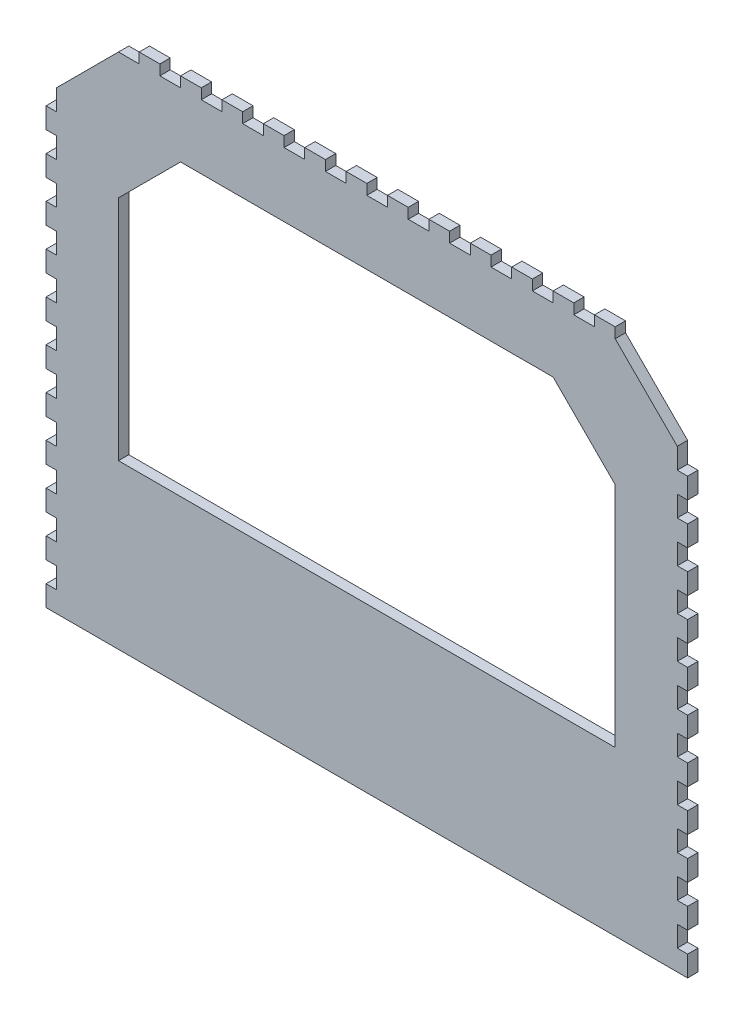
from build123d import *

# Parameters (mm, degrees)
AUFSATZ_LINEAR_AUSTRAGEN1_DEPTH = 5


with BuildPart() as part:
    # Skizze1 → Aufsatz-Linear austragen1 (new body)
    with BuildSketch(Plane.XY):
        Polygon((430.89618142, 326.340211581), (430.89618142, 336.340211581), (425.89618142, 336.340211581), (425.89618142, 346.340211581), (430.89618142, 346.340211581), (430.89618142, 356.340211581), (425.89618142, 356.340211581), (425.89618142, 366.340211581), (430.89618142, 366.340211581), (430.89618142, 376.340211581), (425.89618142, 376.340211581), (425.89618142, 386.340211581), (430.89618142, 386.340211581), (430.89618142, 396.340211581), (425.89618142, 396.340211581), (425.89618142, 406.340211581), (430.89618142, 406.340211581), (430.89618142, 416.340211581), (425.89618142, 416.340211581), (425.89618142, 426.340211581), (430.89618142, 426.340211581), (430.89618142, 436.340211581), (425.89618142, 436.340211581), (425.89618142, 446.340211581), (430.89618142, 446.340211581), (430.89618142, 456.340211581), (425.89618142, 456.340211581), (425.89618142, 466.340211581), (430.89618142, 466.340211581), (430.89618142, 476.340211581), (425.89618142, 476.340211581), (425.89618142, 486.340211581), (430.89618142, 486.340211581), (430.89618142, 496.340211581), (425.89618142, 496.340211581), (425.89618142, 506.340211581), (430.89618142, 506.340211581), (430.89618142, 516.340211581), (425.89618142, 516.340211581), (425.89618142, 526.340211581), (430.89618142, 526.340211581), (430.89618142, 536.340211581), (460.89618142, 566.340211581), (470.89618142, 566.340211581), (470.89618142, 571.340211581), (480.89618142, 571.340211581), (480.89618142, 566.340211581), (490.89618142, 566.340211581), (490.89618142, 571.340211581), (500.89618142, 571.340211581), (500.89618142, 566.340211581), (510.89618142, 566.340211581), (510.89618142, 571.340211581), (520.89618142, 571.340211581), (520.89618142, 566.340211581), (530.89618142, 566.340211581), (530.89618142, 571.340211581), (540.89618142, 571.340211581), (540.89618142, 566.340211581), (550.89618142, 566.340211581), (550.89618142, 571.340211581), (560.89618142, 571.340211581), (560.89618142, 566.340211581), (570.89618142, 566.340211581), (570.89618142, 571.340211581), (580.89618142, 571.340211581), (580.89618142, 566.340211581), (590.89618142, 566.340211581), (590.89618142, 571.340211581), (600.89618142, 571.340211581), (600.89618142, 566.340211581), (610.89618142, 566.340211581), (610.89618142, 571.340211581), (620.89618142, 571.340211581), (620.89618142, 566.340211581), (630.89618142, 566.340211581), (630.89618142, 571.340211581), (640.89618142, 571.340211581), (640.89618142, 566.340211581), (650.89618142, 566.340211581), (650.89618142, 571.340211581), (660.89618142, 571.340211581), (660.89618142, 566.340211581), (670.89618142, 566.340211581), (670.89618142, 571.340211581), (680.89618142, 571.340211581), (680.89618142, 566.340211581), (690.89618142, 566.340211581), (690.89618142, 571.340211581), (700.89618142, 571.340211581), (700.89618142, 566.340211581), (730.89618142, 536.340211581), (730.89618142, 526.340211581), (735.89618142, 526.340211581), (735.89618142, 516.340211581), (730.89618142, 516.340211581), (730.89618142, 506.340211581), (735.89618142, 506.340211581), (735.89618142, 496.340211581), (730.89618142, 496.340211581), (730.89618142, 486.340211581), (735.89618142, 486.340211581), (735.89618142, 476.340211581), (730.89618142, 476.340211581), (730.89618142, 466.340211581), (735.89618142, 466.340211581), (735.89618142, 456.340211581), (730.89618142, 456.340211581), (730.89618142, 446.340211581), (735.89618142, 446.340211581), (735.89618142, 436.340211581), (730.89618142, 436.340211581), (730.89618142, 426.340211581), (735.89618142, 426.340211581), (735.89618142, 416.340211581), (730.89618142, 416.340211581), (730.89618142, 406.340211581), (735.89618142, 406.340211581), (735.89618142, 396.340211581), (730.89618142, 396.340211581), (730.89618142, 386.340211581), (735.89618142, 386.340211581), (735.89618142, 376.340211581), (730.89618142, 376.340211581), (730.89618142, 366.340211581), (735.89618142, 366.340211581), (735.89618142, 356.340211581), (730.89618142, 356.340211581), (730.89618142, 346.340211581), (735.89618142, 346.340211581), (735.89618142, 336.340211581), (730.89618142, 336.340211581), (730.89618142, 326.340211581), (735.89618142, 326.340211581), (735.89618142, 316.340211581), (730.89618142, 316.340211581), (430.89618142, 316.340211581), (425.89618142, 316.340211581), (425.89618142, 326.340211581), align=None)
        Polygon((700.89618142, 505.311376979), (670.89618142, 535.311376979), (490.89618142, 535.311376979), (460.89618142, 505.311376979), (460.89618142, 395.311376979), (700.89618142, 395.311376979), align=None, mode=Mode.SUBTRACT)
    extrude(amount=AUFSATZ_LINEAR_AUSTRAGEN1_DEPTH)


solid = part.part
